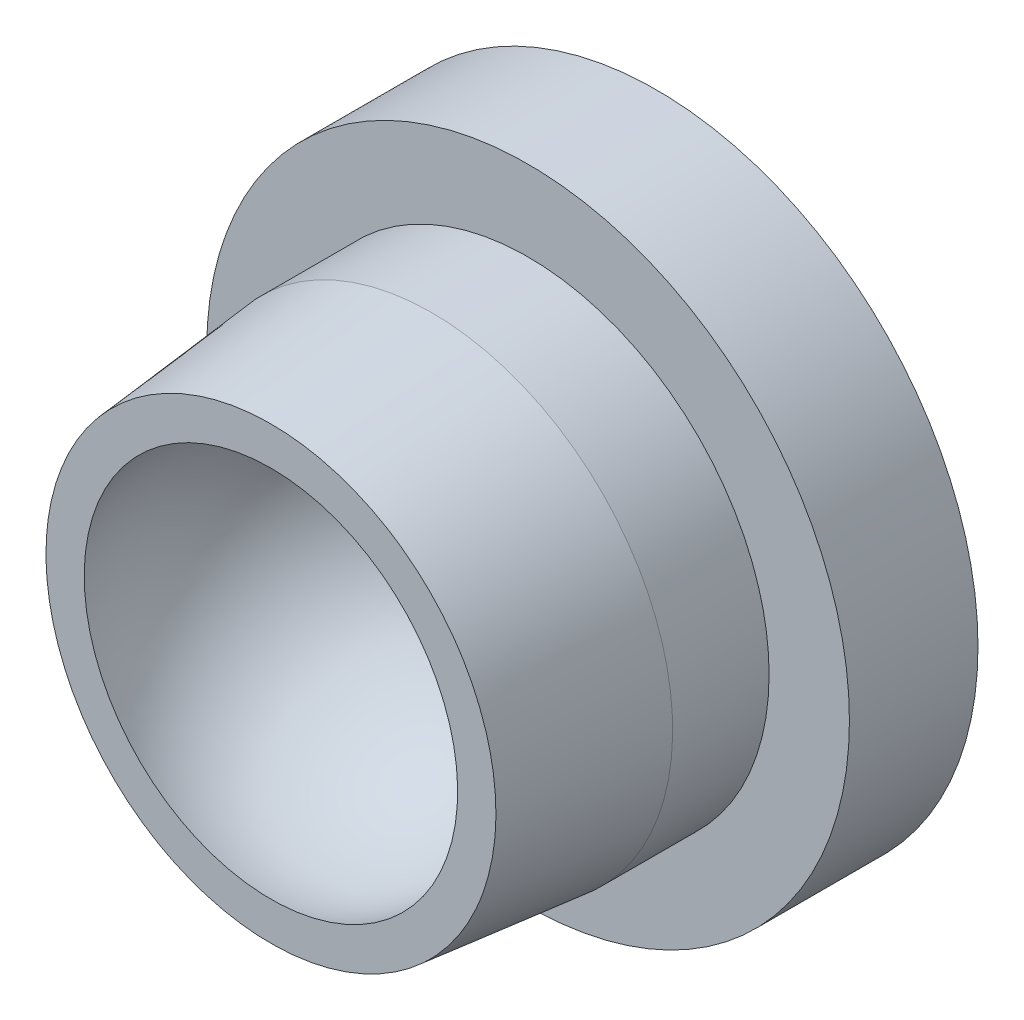
from build123d import *

# Parameters (mm, degrees)
SKETCH_1_R          = 10
EXTRUDE_1_DEPTH     = 4
SKETCH_3_R          = 7
EXTRUDE_2_DEPTH     = 12
SKETCH_4_R          = 7.5
EXTRUDE_3_DEPTH     = 3
SKETCH_5_R          = 4
CUT_EXTRUDE_1_DEPTH = 2
SKETCH_6_R          = 0.5
CUT_EXTRUDE_2_DEPTH = 18.320508076
CUT_EXTRUDE_START   = -1.5
SKETCH_7_R          = 2
CUT_EXTRUDE_3_DEPTH = 16.820508076


# Read off the part's stored shape, not the designer's step: 边界1
with BuildPart() as part:
    # 草图1 → 凸台-拉伸1 (new body)
    with BuildSketch(Plane.XY):
        Circle(SKETCH_1_R)
    extrude(amount=EXTRUDE_1_DEPTH)

    # 草图3 → 凸台-拉伸2 (add)
    with BuildSketch(Plane.XY):
        Circle(SKETCH_3_R)
    extrude(amount=EXTRUDE_2_DEPTH)

    # 草图4 → 凸台-拉伸3 (add)
    with BuildSketch(Plane.XY.offset(4)):
        Circle(SKETCH_4_R)
    extrude(amount=EXTRUDE_3_DEPTH)

    # 边界1 outline → 边界1 (revolve)
    with BuildSketch(Plane.XZ):
        Polygon((7.5, 7), (7, 12), (7, 7), align=None)
    revolve(axis=Axis((0, 0, 0), (0, 0, 1)))

    # 草图5 → 切除-拉伸1 (cut)
    with BuildSketch(Plane(origin=(0, 0, 0), x_dir=(-1, 0, 0), z_dir=(0, 0, -1))):
        Circle(SKETCH_5_R)
    extrude(amount=-CUT_EXTRUDE_1_DEPTH, mode=Mode.SUBTRACT)

    # 草图6 → 切除-拉伸2 (cut, through all)
    with BuildSketch(Plane(origin=(0, 0, 2), x_dir=(-1, 0, 0), z_dir=(0, 0, -1))):
        Circle(SKETCH_6_R)
    extrude(amount=-CUT_EXTRUDE_2_DEPTH, mode=Mode.SUBTRACT)

    # 草图7 → 切除-拉伸3 (cut, through all)
    with BuildSketch(Plane(origin=(0, 0, 2), x_dir=(-1, 0, 0), z_dir=(0, 0, -1)).offset(CUT_EXTRUDE_START)):
        Circle(SKETCH_7_R)
    extrude(amount=-CUT_EXTRUDE_3_DEPTH, mode=Mode.SUBTRACT)

    # 草图8 → 切除-旋转1 (revolve, cut)
    with BuildSketch(Plane(origin=(0, 0, 0), x_dir=(0, 0, -1), z_dir=(1, 0, 0)), mode=Mode.PRIVATE) as cut_revolve_1_sk:
        with BuildLine():
            Line((-12, 0), (-12, 5.809475019))
            ThreePointArc((-12, 5.809475019), (-6.825765386, 4.74341649), (-4.5, 0))
            Line((-4.5, 0), (-12, 0))
        make_face()
    revolve(cut_revolve_1_sk.sketch.rotate(Axis((0, 0, 12), (0, 0, 1)), 286.935860908), axis=Axis((0, 0, 12), (0, 0, 1)), mode=Mode.SUBTRACT)


solid = part.part
